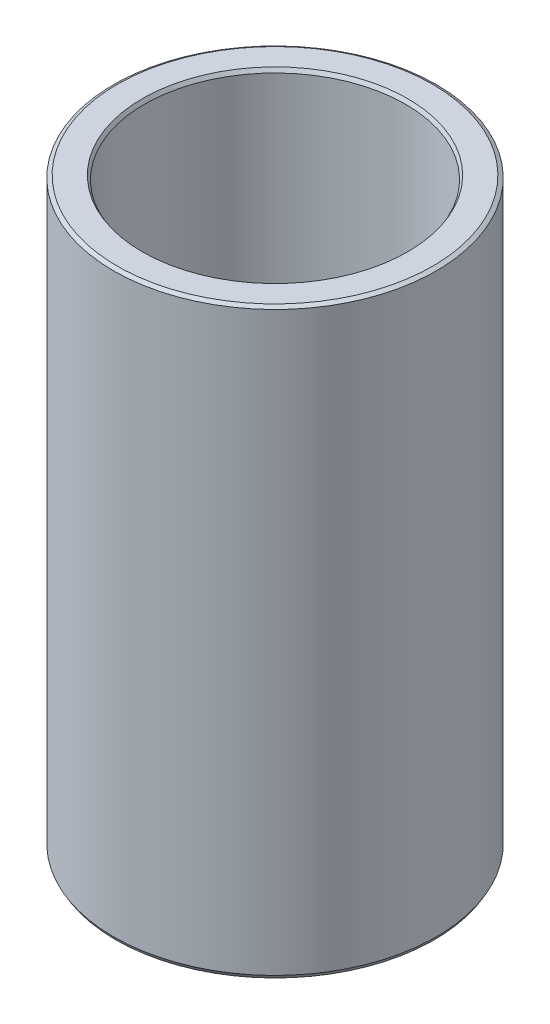
from build123d import *
from OCP.BRepFilletAPI import BRepFilletAPI_MakeChamfer

# Parameters (mm, degrees)
SKETCH1_R           = 40
BOSS_EXTRUDE1_DEPTH = 144.417892776
SKETCH2_R           = 32.356065476
CUT_EXTRUDE1_DEPTH  = 156.101669088
CHAMFER1_SIZE       = 0.536568882
CHAMFER1_SIZE2      = 0.929364566


with BuildPart() as part:
    # Sketch1 → Boss-Extrude1 (new body)
    with BuildSketch(Plane(origin=(0, 0, 0), x_dir=(1, 0, 0), z_dir=(0, 1, 0))):
        Circle(SKETCH1_R)
    extrude(amount=BOSS_EXTRUDE1_DEPTH)

    # Sketch2 → Cut-Extrude1 (cut, through all)
    with BuildSketch(Plane(origin=(0, 0, 0), x_dir=(1, 0, 0), z_dir=(0, 1, 0))):
        Circle(SKETCH2_R)
    extrude(amount=CUT_EXTRUDE1_DEPTH, mode=Mode.SUBTRACT)

    # Chamfer1: one chamfer whose edges measure the first distance from different faces: ONE call of the kernel's chamfer builder (chamfer() names one face for all edges)
    chamfer1_edges_1 = [part.edges().sort_by_distance(p)[0] for p in [
        (-32.356065476, 144.417892776, 0),
    ]]
    chamfer1_side_1 = [part.faces().sort_by_distance(p)[0] for p in [
        (-38.86862915, 144.417892776, 0),
    ]]
    chamfer1_edges_2 = [part.edges().sort_by_distance(p)[0] for p in [
        (-32.356065476, 0, 0),
    ]]
    chamfer1_side_2 = [part.faces().sort_by_distance(p)[0] for p in [
        (-32.356065476, 72.208946388, 0),
    ]]
    chamfer1_edges_3 = [part.edges().sort_by_distance(p)[0] for p in [
        (-40, 0, 0),
    ]]
    chamfer1_side_3 = [part.faces().sort_by_distance(p)[0] for p in [
        (-38.86862915, 0, 0),
    ]]
    chamfer1_edges_4 = [part.edges().sort_by_distance(p)[0] for p in [
        (-40, 144.417892776, 0),
    ]]
    chamfer1_side_4 = [part.faces().sort_by_distance(p)[0] for p in [
        (-40, 72.208946388, 0),
    ]]
    chamfer1 = BRepFilletAPI_MakeChamfer(part.part.solid().wrapped)
    for e in chamfer1_edges_1:
        chamfer1.Add(CHAMFER1_SIZE, CHAMFER1_SIZE2, e.wrapped, chamfer1_side_1[0].wrapped)  # the first distance lies on this face
    for e in chamfer1_edges_2:
        chamfer1.Add(CHAMFER1_SIZE, CHAMFER1_SIZE2, e.wrapped, chamfer1_side_2[0].wrapped)  # the first distance lies on this face
    for e in chamfer1_edges_3:
        chamfer1.Add(CHAMFER1_SIZE, CHAMFER1_SIZE2, e.wrapped, chamfer1_side_3[0].wrapped)  # the first distance lies on this face
    for e in chamfer1_edges_4:
        chamfer1.Add(CHAMFER1_SIZE, CHAMFER1_SIZE2, e.wrapped, chamfer1_side_4[0].wrapped)  # the first distance lies on this face
    add(Compound.cast(chamfer1.Shape()), mode=Mode.REPLACE)


solid = part.part
